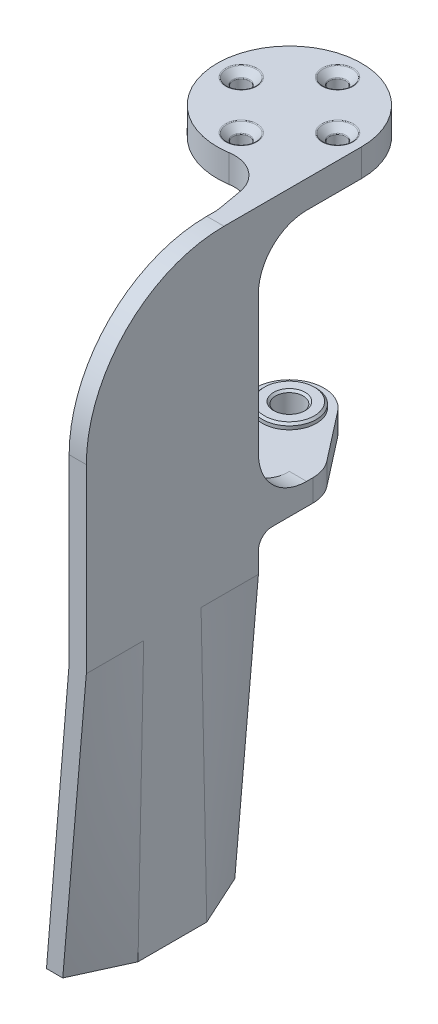
from build123d import *

# Parameters (mm, degrees)
BOSS_EXTRUDE1_DEPTH                                 = 4
CSK_FOR_M2_COUNTERSUNK_FLAT_HEAD_SCREW1_D           = 2.4
CSK_FOR_M2_COUNTERSUNK_FLAT_HEAD_SCREW1_DEPTH       = 4
CSK_FOR_M2_COUNTERSUNK_FLAT_HEAD_SCREW1_CSINK_D     = 4.4
CSK_FOR_M2_COUNTERSUNK_FLAT_HEAD_SCREW1_CSINK_ANGLE = 90
CSK_FOR_M2_COUNTERSUNK_FLAT_HEAD_SCREW1_TIP         = 0.721032743
CUT_EXTRUDE1_DEPTH                                  = 1
BOSS_EXTRUDE2_START                                 = 0.2
SKETCH6_R                                           = 3.92
BOSS_EXTRUDE2_DEPTH                                 = 0.8
BOSS_EXTRUDE3_DEPTH                                 = 3.2
SKETCH10_R                                          = 2
CUT_EXTRUDE2_DEPTH                                  = 5
SKETCH11_R                                          = 3.75
CUT_EXTRUDE3_DEPTH                                  = 0.4
SKETCH12_W                                          = 2.5
SKETCH12_H                                          = 25
BOSS_EXTRUDE4_DEPTH                                 = 46.3
FILLET1_R                                           = 7
FILLET2_R                                           = 20
CHAMFER1_SIZE                                       = 0.3
FILLET3_R                                           = 0.2
CHAMFER2_SIZE                                       = 0.5
FILLET4_R                                           = 0.2
FILLET6_R                                           = 5
FILLET7_R                                           = 2


with BuildPart() as part:
    # Sketch2 → Boss-Extrude1 (new body)
    with BuildSketch(Plane(origin=(0, 33.6, 0), x_dir=(1, 0, 0), z_dir=(0, 1, 0))):
        with BuildLine():
            Line((10.5, 9.7), (10.5, -8.747082129))
            Line((10.5, -8.747082129), (10.5, -30.3))
            Line((10.5, -30.3), (8, -30.3))
            Line((8, -30.3), (8, -8.747082129))
            Line((8, -8.747082129), (6.236730193, 1.252917871))
            ThreePointArc((6.236730193, 1.252917871), (-9.373784375, 14.430979443), (10.5, 9.7))
        make_face()
    extrude(amount=BOSS_EXTRUDE1_DEPTH)

    # CSK for M2 Countersunk Flat Head Screw1
    with Locations(Plane(origin=(0, 37.6, 0), x_dir=(1, 0, 0), z_dir=(0, 1, 0))):
        with Locations((0, 2.7), (7, 9.7), (0, 16.7), (-7, 9.7)):
            CounterSinkHole(CSK_FOR_M2_COUNTERSUNK_FLAT_HEAD_SCREW1_D / 2, CSK_FOR_M2_COUNTERSUNK_FLAT_HEAD_SCREW1_CSINK_D / 2, depth=CSK_FOR_M2_COUNTERSUNK_FLAT_HEAD_SCREW1_DEPTH, counter_sink_angle=CSK_FOR_M2_COUNTERSUNK_FLAT_HEAD_SCREW1_CSINK_ANGLE)
            with Locations((0, 0, -(CSK_FOR_M2_COUNTERSUNK_FLAT_HEAD_SCREW1_DEPTH + CSK_FOR_M2_COUNTERSUNK_FLAT_HEAD_SCREW1_TIP / 2))):  # 118° drill point
                Cone(0, CSK_FOR_M2_COUNTERSUNK_FLAT_HEAD_SCREW1_D / 2, CSK_FOR_M2_COUNTERSUNK_FLAT_HEAD_SCREW1_TIP, mode=Mode.SUBTRACT)

    # Sketch5 → Cut-Extrude1 (cut)
    with BuildSketch(Plane.XZ.offset(-33.6)):
        with BuildLine():
            Line((-4.82, -20.2), (-4.82, -9.7))
            ThreePointArc((-4.82, -9.7), (0, -4.88), (4.82, -9.7))
            Line((4.82, -9.7), (4.82, -20.2))
            ThreePointArc((4.82, -20.2), (0, -25.02), (-4.82, -20.2))
        make_face()
    extrude(amount=-CUT_EXTRUDE1_DEPTH, mode=Mode.SUBTRACT)



with BuildPart() as body_2:
    # Sketch6 → Boss-Extrude2 (new body)
    with BuildSketch(Plane.XZ.offset(-0.5).offset(BOSS_EXTRUDE2_START)):
        with Locations(Location((0, -9.7, 0), (0, 0, 270))):
            Circle(SKETCH6_R)
    extrude(amount=BOSS_EXTRUDE2_DEPTH)

    # Sketch7 → Boss-Extrude3 (add)
    with BuildSketch(Plane.XZ.offset(0.5)):
        with BuildLine():
            Line((-3.948430619, -6.632444679), (8, 8.747082129))
            Line((8, 8.747082129), (8, 30.3))
            Line((8, 30.3), (10.5, 30.3))
            Line((10.5, 30.3), (10.5, -4.334645582))
            Line((10.5, -4.334645582), (3.948430619, -12.767555321))
            ThreePointArc((3.948430619, -12.767555321), (-3.067555321, -13.648430619), (-3.948430619, -6.632444679))
        make_face()
    extrude(amount=BOSS_EXTRUDE3_DEPTH)

    # Sketch10 → Cut-Extrude2 (cut)
    with BuildSketch(Plane.XZ.offset(3.7)):
        with Locations(Location((0, -9.7, 0), (0, 0, 270))):
            Circle(SKETCH10_R)
    extrude(amount=-CUT_EXTRUDE2_DEPTH, mode=Mode.SUBTRACT)

    # Sketch11 → Cut-Extrude3 (cut)
    with BuildSketch(Plane.XZ.offset(3.7)):
        with Locations(Location((0, -9.7, 0), (0, 0, 270))):
            Circle(SKETCH11_R)
    extrude(amount=-CUT_EXTRUDE3_DEPTH, mode=Mode.SUBTRACT)


with BuildPart() as part_1:
    add(part.part)

    add(body_2.part)  # Boss-Extrude4 merges body 2
    # Sketch12 → Boss-Extrude4 (add)
    with BuildSketch(Plane(origin=(0, 37.6, 0), x_dir=(1, 0, 0), z_dir=(0, 1, 0))):
        with Locations((9.25, -17.8)):
            Rectangle(SKETCH12_W, SKETCH12_H)
    extrude(amount=-BOSS_EXTRUDE4_DEPTH)

    # Fillet1
    fillet1_edges = [part_1.edges().sort_by_distance(p)[0] for p in [
        (9.25, 33.6, 5.3),
        (9.25, -0.5, 5.3),
    ]]
    fillet(fillet1_edges, radius=FILLET1_R)

    # Fillet2
    fillet2_edges = [part_1.edges().sort_by_distance(p)[0] for p in [
        (9.25, 37.6, 30.3),
    ]]
    fillet(fillet2_edges, radius=FILLET2_R)

    # Chamfer1
    chamfer1_edges = [part_1.edges().sort_by_distance(p)[0] for p in [
        (0, 0.3, -7.7),
        (0, 0.3, -5.78),
    ]]
    chamfer(chamfer1_edges, length=CHAMFER1_SIZE)

    # Fillet3
    fillet3_edges = [part_1.edges().sort_by_distance(p)[0] for p in [
        (0, -3.3, -5.95),
        (0, -3.3, -7.7),
    ]]
    fillet(fillet3_edges, radius=FILLET3_R)

    # Chamfer2
    # the kernel refuses this chamfer: 0.5, 0.371068727 mm, written as the material it takes off along each edge
    with BuildSketch(Plane(origin=(-4.82, 34.6, -19.028322464), x_dir=(-0.8802070458412009, 0, 0.47458988237372485), z_dir=(0, -1, 0))) as chamfer2_piece_1:
        with BuildLine():
            Line((0.369059, 0), (CHAMFER2_SIZE * 0.474589882374, -CHAMFER2_SIZE * 0.880207045841))
            Line((CHAMFER2_SIZE * 0.474589882374, -CHAMFER2_SIZE * 0.880207045841), (0, 0))
            ThreePointArc((0, 0), (0.187395474, 0.001621217), (0.369059, 0))
        make_face()
    extrude(amount=2.285841494, mode=Mode.SUBTRACT)
    with BuildSketch(Plane(origin=(4.82, 34.6, -19.028322464), x_dir=(0.8802070458411981, 0, 0.47458988237373034), z_dir=(0, -1, 0))) as chamfer2_piece_2:
        with BuildLine():
            Line((0.369059, 0), (CHAMFER2_SIZE * 0.474589882374, CHAMFER2_SIZE * 0.880207045841))
            Line((CHAMFER2_SIZE * 0.474589882374, CHAMFER2_SIZE * 0.880207045841), (0, 0))
            ThreePointArc((0, 0), (0.187395474, -0.001621217), (0.369059, 0))
        make_face()
    extrude(amount=2.285841494, mode=Mode.SUBTRACT)
    with BuildSketch(Plane(origin=(0, 34.6, -9.7), x_dir=(-0.5641489275295863, 0, -0.825673051254077), z_dir=(-0.825673051254077, 0, 0.5641489275295863))) as chamfer2_piece_3_section:
        Polygon((10.5, -CHAMFER2_SIZE), (10.5 - CHAMFER2_SIZE, 0), (10.5, 0), align=None)
    chamfer2_piece_3 = revolve(axis=Axis((0, 34.6, -9.7), (0, -1, 0)), revolution_arc=68.686424342, mode=Mode.PRIVATE)
    chamfer2_piece_3 = split(chamfer2_piece_3, bisect_by=Plane(origin=(-4.82, 34.6, -9.7), z_dir=(1, 0, 0)), keep=Keep.TOP, mode=Mode.PRIVATE)
    chamfer2_piece_3 = split(chamfer2_piece_3, bisect_by=Plane(origin=(4.82, 34.6, -9.7), z_dir=(-1, 0, 0)), keep=Keep.TOP, mode=Mode.PRIVATE)
    add(chamfer2_piece_3, mode=Mode.SUBTRACT)
    with BuildSketch(Plane(origin=(-4.82, 35.885841494, -19.028322464), x_dir=(-0.8802070458412009, 0, 0.47458988237372485), z_dir=(0, -1, 0))) as chamfer2_piece_4a_section:
        with BuildLine():
            Line((0.369059, 0), (CHAMFER2_SIZE * 0.474589882374, -CHAMFER2_SIZE * 0.880207045841))
            Line((CHAMFER2_SIZE * 0.474589882374, -CHAMFER2_SIZE * 0.880207045841), (0, 0))
            ThreePointArc((0, 0), (0.187395474, 0.001621217), (0.369059, 0))
        make_face()
    chamfer2_piece_4a = extrude(amount=3.571682988, mode=Mode.PRIVATE)
    chamfer2_piece_4a = split(chamfer2_piece_4a, bisect_by=Plane(origin=(-4.82, 34.6, -19.028322464), z_dir=(0, 1, 0)), keep=Keep.TOP, mode=Mode.PRIVATE)
    with BuildSketch(Plane(origin=(0, 34.6, -9.7), x_dir=(-0.5641489275295863, 0, -0.825673051254077), z_dir=(-0.825673051254077, 0, 0.5641489275295863))) as chamfer2_piece_4b_section:
        Polygon((10.5, -CHAMFER2_SIZE), (10.5 - CHAMFER2_SIZE, 0), (10.5, 0), align=None)
    chamfer2_piece_4b = revolve(axis=Axis((0, 34.6, -9.7), (0, -1, 0)), revolution_arc=68.686424342, mode=Mode.PRIVATE)
    chamfer2_piece_4b = split(chamfer2_piece_4b, bisect_by=Plane(origin=(-4.82, 34.6, -9.7), z_dir=(-1, 0, 0)), keep=Keep.TOP, mode=Mode.PRIVATE)
    chamfer2_piece_4 = chamfer2_piece_4a & chamfer2_piece_4b
    add(chamfer2_piece_4, mode=Mode.SUBTRACT)
    with BuildSketch(Plane(origin=(0, 34.6, -9.7), x_dir=(-0.5641489275295863, 0, -0.825673051254077), z_dir=(-0.825673051254077, 0, 0.5641489275295863))) as chamfer2_piece_5a_section:
        Polygon((10.5, -CHAMFER2_SIZE), (10.5 - CHAMFER2_SIZE, 0), (10.5, 0), align=None)
    chamfer2_piece_5a = revolve(axis=Axis((0, 34.6, -9.7), (0, -1, 0)), revolution_arc=68.686424342, mode=Mode.PRIVATE)
    chamfer2_piece_5a = split(chamfer2_piece_5a, bisect_by=Plane(origin=(4.82, 34.6, -9.7), z_dir=(1, 0, 0)), keep=Keep.TOP, mode=Mode.PRIVATE)
    with BuildSketch(Plane(origin=(4.82, 35.885841494, -19.028322464), x_dir=(0.8802070458411981, 0, 0.47458988237373034), z_dir=(0, -1, 0))) as chamfer2_piece_5b_section:
        with BuildLine():
            Line((0.369059, 0), (CHAMFER2_SIZE * 0.474589882374, CHAMFER2_SIZE * 0.880207045841))
            Line((CHAMFER2_SIZE * 0.474589882374, CHAMFER2_SIZE * 0.880207045841), (0, 0))
            ThreePointArc((0, 0), (0.187395474, -0.001621217), (0.369059, 0))
        make_face()
    chamfer2_piece_5b = extrude(amount=3.571682988, mode=Mode.PRIVATE)
    chamfer2_piece_5b = split(chamfer2_piece_5b, bisect_by=Plane(origin=(4.82, 34.6, -19.028322464), z_dir=(0, 1, 0)), keep=Keep.TOP, mode=Mode.PRIVATE)
    chamfer2_piece_5 = chamfer2_piece_5a & chamfer2_piece_5b
    add(chamfer2_piece_5, mode=Mode.SUBTRACT)

    # Fillet4
    fillet4_edges = [part_1.edges().sort_by_distance(p)[0] for p in [
        (-4.8, 37.6, -9.7),
        (-5.8, 33.6, -9.7),
        (-5.8, 36.6, -9.7),
        (2.2, 37.6, -16.7),
        (1.2, 36.6, -16.7),
        (9.2, 37.6, -9.7),
        (8.2, 33.6, -9.7),
        (8.2, 36.6, -9.7),
        (2.2, 37.6, -2.7),
        (1.2, 33.6, -2.7),
        (1.2, 36.6, -2.7),
        (1.2, 34.6, -16.7),
    ]]
    fillet(fillet4_edges, radius=FILLET4_R)

    # Fillet6
    fillet6_edges = [part_1.edges().sort_by_distance(p)[0] for p in [
        (10.5, -2.1, -4.334645582),
        (8, 35.6, 8.747082129),
        (6.236730193, 35.6, -1.252917871),
    ]]
    fillet(fillet6_edges, radius=FILLET6_R)

    # Fillet7
    fillet7_edges = [part_1.edges().sort_by_distance(p)[0] for p in [
        (9.25, -3.7, 5.3),
    ]]
    fillet(fillet7_edges, radius=FILLET7_R)

    # Loft1: read off the stored shape, not the designer's step
    # Loft1: loft between two sections, ruled curve by curve
    loft1_from = [
        Edge.make_bspline([(8, -8.7, 30.3), (8, -8.7, 28.911111111), (8, -8.7, 27.522222222), (8, -8.7, 24.744444444), (8, -8.7, 23.355555556), (8, -8.7, 21.966666667)], [0, 0, 0, 0, 0.5, 0.5, 1, 1, 1, 1], 3),
        Edge.make_bspline([(8, -8.7, 13.633333333), (8, -8.7, 12.244444444), (8, -8.7, 10.855555556), (8, -8.7, 8.077777778), (8, -8.7, 6.688888889), (8, -8.7, 5.3)], [0, 0, 0, 0, 0.5, 0.5, 1, 1, 1, 1], 3),
        Edge.make_bspline([(10.5, -8.7, 5.3), (10.5, -8.7, 6.688888889), (10.5, -8.7, 8.077777778), (10.5, -8.7, 10.855555556), (10.5, -8.7, 12.244444444), (10.5, -8.7, 13.633333333)], [0, 0, 0, 0, 0.5, 0.5, 1, 1, 1, 1], 3),
        Edge.make_bspline([(10.5, -8.7, 21.966666667), (10.5, -8.7, 23.355555556), (10.5, -8.7, 24.744444444), (10.5, -8.7, 27.522222222), (10.5, -8.7, 28.911111111), (10.5, -8.7, 30.3)], [0, 0, 0, 0, 0.5, 0.5, 1, 1, 1, 1], 3),
        Edge.make_line((8, -8.7, 13.633333333), (8, -8.7, 21.966666667)),
        Edge.make_line((10.5, -8.7, 5.3), (8, -8.7, 5.3)),
        Edge.make_line((10.5, -8.7, 30.3), (8, -8.7, 30.3)),
        Edge.make_line((10.5, -8.7, 21.966666667), (10.5, -8.7, 13.633333333)),
    ]
    loft1_to = [
        Edge.make_bspline([(4.708286934, -48.7, 30.3), (5.340239112, -48.7, 28.916666667), (5.972191289, -48.7, 27.533333333), (7.236095645, -48.7, 24.766666667), (7.868047822, -48.7, 23.383333333), (8.5, -48.7, 22)], [0, 0, 0, 0, 0.5, 0.5, 1, 1, 1, 1], 3),
        Edge.make_bspline([(8.5, -48.7, 13.6), (7.868047822, -48.7, 12.216666667), (7.236095645, -48.7, 10.833333333), (5.972191289, -48.7, 8.066666667), (5.340239112, -48.7, 6.683333333), (4.708286934, -48.7, 5.3)], [0, 0, 0, 0, 0.5, 0.5, 1, 1, 1, 1], 3),
        Edge.make_bspline([(7.071307506, -48.7, 5.3), (7.642756255, -48.7, 6.550892284), (8.214205004, -48.7, 7.801784568), (9.357102502, -48.7, 10.303569136), (9.928551251, -48.7, 11.554461419), (10.5, -48.7, 12.805353703)], [0, 0, 0, 0, 0.5, 0.5, 1, 1, 1, 1], 3),
        Edge.make_bspline([(10.5, -48.7, 22.794646297), (9.928551251, -48.7, 24.045538581), (9.357102502, -48.7, 25.296430864), (8.214205004, -48.7, 27.798215432), (7.642756255, -48.7, 29.049107716), (7.071307506, -48.7, 30.3)], [0, 0, 0, 0, 0.5, 0.5, 1, 1, 1, 1], 3),
        Edge.make_line((8.5, -48.7, 13.6), (8.5, -48.7, 22)),
        Edge.make_line((7.071307506, -48.7, 5.3), (4.708286934, -48.7, 5.3)),
        Edge.make_line((7.071307506, -48.7, 30.3), (4.708286934, -48.7, 30.3)),
        Edge.make_line((10.5, -48.7, 22.794646297), (10.5, -48.7, 12.805353703)),
    ]
    loft1 = Solid(Shell([*[Face.make_surface_from_curves(loft1_from[k], loft1_to[k]) for k in range(8)], Face(Wire(loft1_from)), Face(Wire(loft1_to))]))
    add(loft1)


solid = part_1.part
